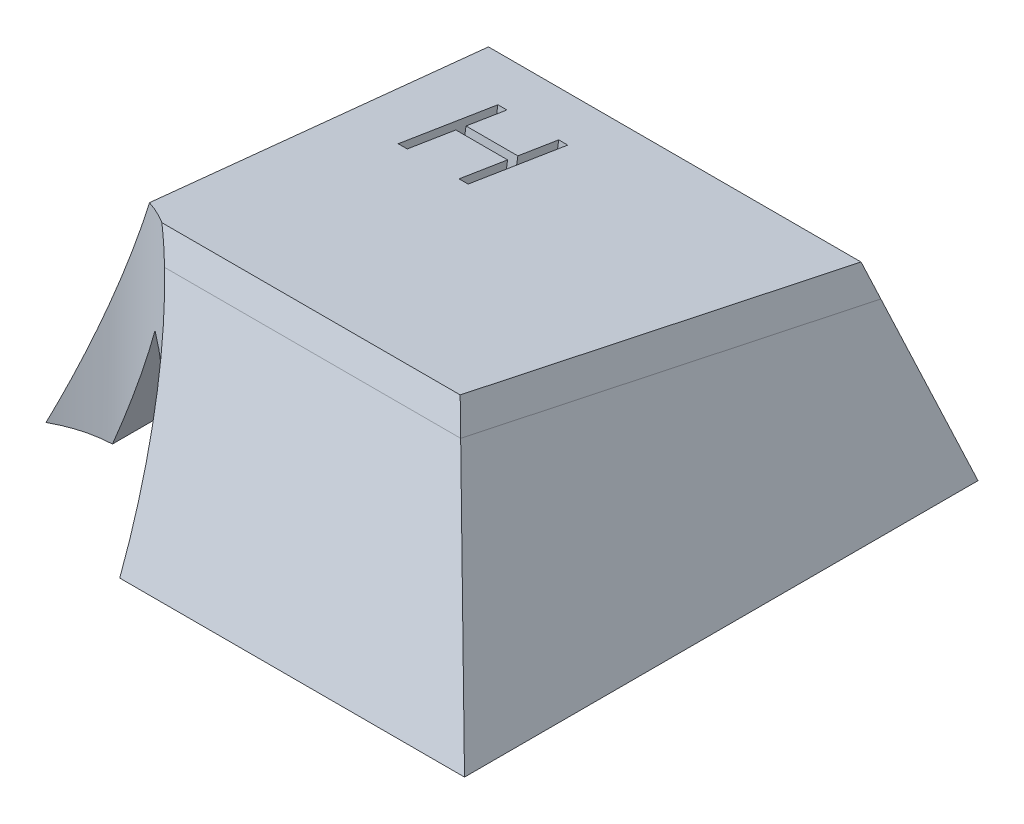
from build123d import *

# Parameters (mm, degrees)
OTHER_START         = 7.189240539
OTHER_2_OUTLINE_W   = 16
OTHER_2_OUTLINE_H   = 16
OTHER_2_DEPTH       = 1.9877561
SKETCH_20_R         = 2.8
EXTRUDE_2_DEPTH     = 6.5
SKETCH_22_R         = 4
CUT_EXTRUDE_2_DEPTH = 9
CUT_EXTRUDE_3_DEPTH = 0.5


# Read off the part's stored shape, not the designer's step: 相交2
with BuildPart() as part:
    # 草图4 → Loft 1 section 0
    with BuildSketch(Plane(origin=(0, 8.2, 0), x_dir=(1, 0, 0), z_dir=(0, 1, 0))):
        with BuildLine():
            Line((-5.6, 6.8), (5.6, 6.8))
            Line((5.6, 6.8), (5.6, -5.7))
            Line((5.6, -5.7), (-5.6, -5.7))
            Line((-5.6, -5.7), (-5.6, 6.8))
        make_face()
    # 草图1 → Loft 1 section 1
    with BuildSketch(Plane(origin=(0, 0, 0), x_dir=(1, 0, 0), z_dir=(0, 1, 0))):
        with BuildLine():
            Line((-8.95, -8.9), (8.95, -8.9))
            Line((8.95, -8.9), (8.95, 8.9))
            Line((8.95, 8.9), (-8.95, 8.9))
            Line((-8.95, 8.9), (-8.95, -8.9))
        make_face()
    loft()

    # 相交2 outline → 相交2 (cut)
    with BuildSketch(Plane(origin=(0, 0, 0), x_dir=(1, 0, 0), z_dir=(0, 0.9872752829851917, -0.15902048800865198)).offset(OTHER_START)):
        Rectangle(OTHER_2_OUTLINE_W, OTHER_2_OUTLINE_H)
    extrude(amount=OTHER_2_DEPTH, mode=Mode.SUBTRACT)

    # 草图19 → Loft 1 2 section 0
    with BuildSketch(Plane(origin=(0, 6.132664073, -0.987788564), x_dir=(1, 0, 0), z_dir=(0, 0.9872752829851916, -0.15902048800865207))):
        with BuildLine():
            Line((-4.985089723, 5.299749211), (4.985089723, 5.299749211))
            Line((4.985089723, 5.299749211), (4.287230721, -5.442213697))
            Line((4.287230721, -5.442213697), (-4.287230721, -5.442213697))
            Line((-4.287230721, -5.442213697), (-4.985089723, 5.299749211))
        make_face()
    # 草图8 → Loft 1 2 section 1
    with BuildSketch(Plane.XZ):
        with BuildLine():
            Line((-7.15, 7.2), (7.15, 7.2))
            Line((7.15, 7.2), (7.15, -7.5))
            Line((7.15, -7.5), (-7.15, -7.5))
            Line((-7.15, -7.5), (-7.15, 7.2))
        make_face()
    loft(mode=Mode.SUBTRACT)

    # 草图20 → 凸台-拉伸2 (add)
    with BuildSketch(Plane.XZ):
        with Locations(Location((0, 0, 0), (0, 0, 270))):
            Circle(SKETCH_20_R)
        Polygon((-2.2, 0.8), (-0.8, 0.8), (-0.8, 2.2), (0.8, 2.2), (0.8, 0.8), (2.2, 0.8), (2.2, -0.8), (0.8, -0.8), (0.8, -2.2), (-0.8, -2.2), (-0.8, -0.8), (-2.2, -0.8), align=None, mode=Mode.SUBTRACT)
    extrude(amount=-EXTRUDE_2_DEPTH)

    # 草图22 → 切除-拉伸2 (cut)
    with BuildSketch(Plane.XZ):
        with Locations((-7, 9)):
            Circle(SKETCH_22_R)
    extrude(amount=-CUT_EXTRUDE_2_DEPTH, mode=Mode.SUBTRACT)

    # 草图23 → 切除-拉伸3 (cut)
    with BuildSketch(Plane(origin=(0, 7.097759487, -1.143236539), x_dir=(1, 0, 0), z_dir=(0, 0.9872752829851916, -0.15902048800865207))):
        Polygon((-4.255442902, 4.374408411), (-3.941340338, 4.374408411), (-3.941340338, 2.938510975), (-2.146468543, 2.938510975), (-2.146468543, 4.374408411), (-1.832365979, 4.374408411), (-1.832365979, 0.874408411), (-2.146468543, 0.874408411), (-2.146468543, 2.579536616), (-3.941340338, 2.579536616), (-3.941340338, 0.874408411), (-4.255442902, 0.874408411), align=None)
    extrude(amount=-CUT_EXTRUDE_3_DEPTH, mode=Mode.SUBTRACT)


solid = part.part
